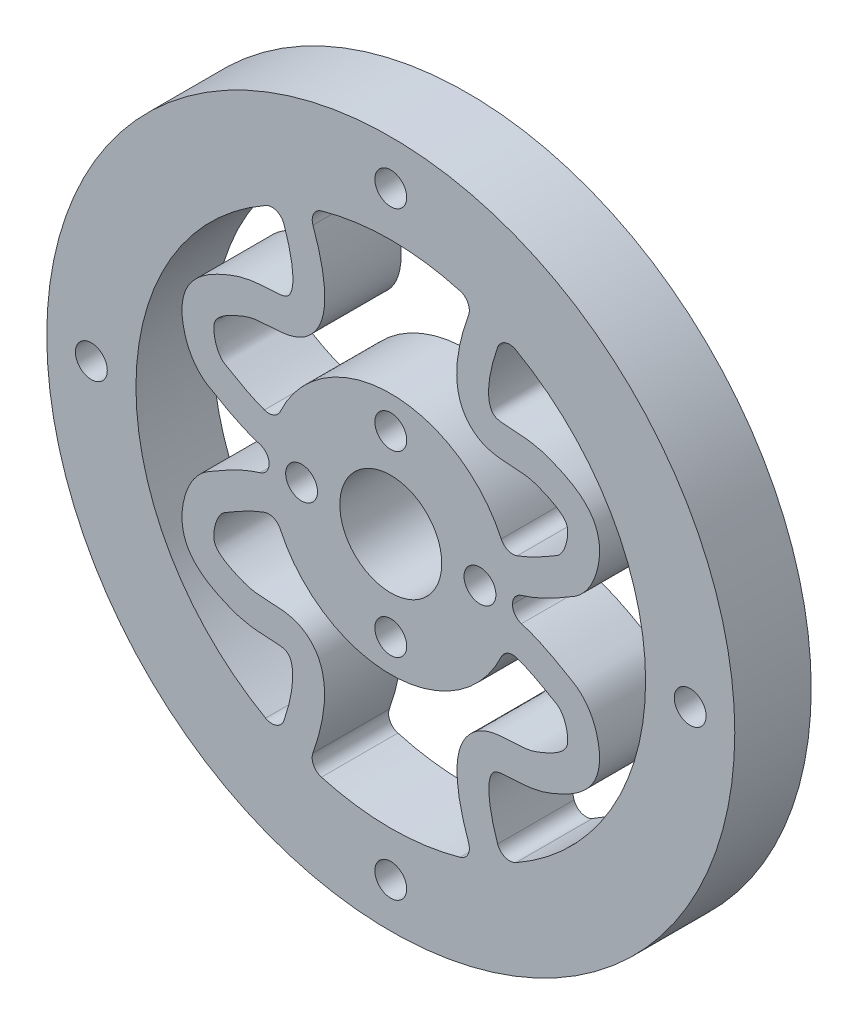
from build123d import *

# Parameters (mm, degrees)
BOSS_EXTRUDE1_OUTLINE_R   = 27
BOSS_EXTRUDE1_OUTLINE_R_2 = 1.25
BOSS_EXTRUDE1_OUTLINE_R_3 = 4
BOSS_EXTRUDE1_DEPTH       = 6
FILLET1_R                 = 1


# Read off the part's stored shape, not the designer's step: Boss-Extrude1
with BuildPart() as part:
    # Boss-Extrude1 outline → Boss-Extrude1 (new body)
    with BuildSketch(Plane.XY):
        Circle(BOSS_EXTRUDE1_OUTLINE_R)
        with Locations((0, -23.5)):
            Circle(BOSS_EXTRUDE1_OUTLINE_R_2, mode=Mode.SUBTRACT)
        with BuildLine():
            add(Edge.make_bspline(
                [(6.483801843, -18.919839155), (6.480612205, -18.912032776), (6.441503957, -18.816167051), (6.347612357, -18.58122213), (6.119029267, -17.980388927), (5.789810817, -17.013794353), (5.429669957, -15.668496809), (5.191806498, -14.230135337), (5.175407974, -12.761834066), (5.524401823, -11.283291588), (6.409718684, -10.166991751), (7.454125678, -9.625091073), (8.350033292, -9.42542645), (9.170309196, -9.376479516), (9.947678619, -9.350570154), (10.675240534, -9.288463207), (11.237211138, -9.169079776), (11.932036453, -8.89638821), (12.637697815, -8.576891164), (13.211834821, -8.233451201), (13.613150576, -7.882315625), (13.813065964, -7.569945647), (13.896838471, -7.281813359), (13.879539964, -6.641593544), (13.73039878, -6.059941379), (13.55175681, -5.653270156), (13.396702845, -5.396835282), (13.265283039, -5.238744867), (13.160626685, -5.14359219), (13.101918554, -5.098485448), (12.979648753, -5.022079201), (12.577995362, -4.7934595), (11.724742054, -4.291783433), (10.601060528, -3.730602471), (9.652508015, -3.377233049), (9.21951845, -3.260097231), (8.993066806, -3.214723866)],
                knots=[0.007762367, 0.007762367, 0.007762367, 0.007762367, 0.009702959, 0.03125, 0.0625, 0.125, 0.1875, 0.25, 0.3125, 0.375, 0.4375, 0.46875, 0.5, 0.53125, 0.5625, 0.59375, 0.625, 0.65625, 0.6875, 0.71875, 0.75, 0.78125, 0.8125, 0.84375, 0.875, 0.890625, 0.90625, 0.921875, 0.9296875, 0.9375, 0.9453125, 0.953125, 0.96875, 0.984375, 0.9921875, 1, 1, 1, 1], degree=3))
            ThreePointArc((6.483801843, -18.919839155), (0, -20), (-6.483801843, -18.919839155))
            add(Edge.make_bspline(
                [(-6.483801843, -18.919839155), (-6.480612205, -18.912032776), (-6.441503957, -18.816167051), (-6.347612357, -18.58122213), (-6.119029267, -17.980388927), (-5.789810817, -17.013794353), (-5.429669957, -15.668496809), (-5.191806498, -14.230135337), (-5.175407974, -12.761834066), (-5.524401823, -11.283291588), (-6.409718684, -10.166991751), (-7.454125678, -9.625091073), (-8.350033292, -9.42542645), (-9.170309196, -9.376479516), (-9.947678619, -9.350570154), (-10.675240534, -9.288463207), (-11.237211138, -9.169079776), (-11.932036453, -8.89638821), (-12.637697815, -8.576891164), (-13.211834821, -8.233451201), (-13.613150576, -7.882315625), (-13.813065964, -7.569945647), (-13.896838471, -7.281813359), (-13.879539964, -6.641593544), (-13.73039878, -6.059941379), (-13.55175681, -5.653270156), (-13.396702845, -5.396835282), (-13.265283039, -5.238744867), (-13.160626685, -5.14359219), (-13.101918554, -5.098485448), (-12.979648753, -5.022079201), (-12.577995362, -4.7934595), (-11.724742054, -4.291783433), (-10.601060528, -3.730602471), (-9.652508015, -3.377233049), (-9.21951845, -3.260097231), (-8.993066806, -3.214723866)],
                knots=[0.007762367, 0.007762367, 0.007762367, 0.007762367, 0.009702959, 0.03125, 0.0625, 0.125, 0.1875, 0.25, 0.3125, 0.375, 0.4375, 0.46875, 0.5, 0.53125, 0.5625, 0.59375, 0.625, 0.65625, 0.6875, 0.71875, 0.75, 0.78125, 0.8125, 0.84375, 0.875, 0.890625, 0.90625, 0.921875, 0.9296875, 0.9375, 0.9453125, 0.953125, 0.96875, 0.984375, 0.9921875, 1, 1, 1, 1], degree=3))
            ThreePointArc((-8.993066806, -3.214723866), (0, -9.550376962), (8.993066806, -3.214723866))
        make_face(mode=Mode.SUBTRACT)
        with Locations((0, -7)):
            Circle(BOSS_EXTRUDE1_OUTLINE_R_2, mode=Mode.SUBTRACT)
        with Locations((-23.5, 0)):
            Circle(BOSS_EXTRUDE1_OUTLINE_R_2, mode=Mode.SUBTRACT)
        with BuildLine():
            add(Edge.make_bspline(
                [(-8.793765965, -17.963008661), (-8.790561612, -17.955152681), (-8.757299555, -17.873459033), (-8.675456351, -17.668379774), (-8.473919568, -17.138762569), (-8.182262794, -16.281745106), (-7.874017475, -15.126473634), (-7.688580164, -13.981174059), (-7.68708969, -12.988779781), (-7.882450811, -12.340385911), (-8.105574911, -12.101711107), (-8.427286637, -11.936185887), (-9.255887466, -11.873584818), (-10.061993387, -11.846676872), (-10.980530297, -11.780784628), (-12.037855007, -11.548544014), (-12.901369588, -11.200056501), (-14.054290483, -10.681134366), (-15.231238441, -9.924658048), (-16.128927134, -8.661627788), (-16.433708137, -7.419671476), (-16.361750971, -6.266622794), (-16.068776901, -5.081044273), (-15.596575411, -4.134652828), (-15.106286502, -3.535992931), (-14.774613082, -3.227707308), (-14.488277389, -3.0127142), (-14.214236794, -2.847608081), (-13.840221024, -2.635292087), (-12.932474986, -2.101308455), (-11.383068607, -1.322241381), (-10.154677906, -0.901179774), (-9.522201544, -0.770857912), (-9.519265086, -0.770254719)],
                knots=[0.008782184, 0.008782184, 0.008782184, 0.008782184, 0.01097773, 0.03125, 0.0625, 0.125, 0.1875, 0.25, 0.3125, 0.375, 0.4375, 0.5, 0.53125, 0.5625, 0.59375, 0.625, 0.65625, 0.6875, 0.75, 0.78125, 0.8125, 0.84375, 0.875, 0.90625, 0.921875, 0.9296875, 0.9375, 0.9453125, 0.953125, 0.96875, 0.984375, 0.999644738, 0.99971579, 0.99971579, 0.99971579, 0.99971579], degree=3))
            ThreePointArc((-8.793765965, -17.963008661), (-20, 0), (-8.793765965, 17.963008661))
            add(Edge.make_bspline(
                [(-8.793765965, 17.963008661), (-8.792390185, 17.959667216), (-8.751090896, 17.859289875), (-8.659149113, 17.630898508), (-8.442492857, 17.062585707), (-8.150200233, 16.204626452), (-7.847022713, 15.063271185), (-7.669490667, 13.941546746), (-7.675936835, 12.977642097), (-7.87172167, 12.356105989), (-8.096556435, 12.116445797), (-8.437268015, 11.945555936), (-9.265970028, 11.877370514), (-10.069148732, 11.843745886), (-10.982990761, 11.771223658), (-12.032129114, 11.536768835), (-12.892956915, 11.190784402), (-14.04568893, 10.675396667), (-15.225024196, 9.924481098), (-16.127345354, 8.662487813), (-16.433024316, 7.418347937), (-16.360717665, 6.265882856), (-16.068019021, 5.080296428), (-15.595762735, 4.133827462), (-15.105222866, 3.535092161), (-14.773373049, 3.226801646), (-14.486865721, 3.011813821), (-14.212855625, 2.846812002), (-13.839019105, 2.634637657), (-12.931736587, 2.100862468), (-11.383019871, 1.3220545), (-10.15471139, 0.901122285), (-9.522198334, 0.770856958), (-9.519265086, 0.770254719)],
                knots=[0.003708072, 0.003708072, 0.003708072, 0.003708072, 0.00463509, 0.03125, 0.0625, 0.125, 0.1875, 0.25, 0.3125, 0.375, 0.4375, 0.5, 0.53125, 0.5625, 0.59375, 0.625, 0.65625, 0.6875, 0.75, 0.78125, 0.8125, 0.84375, 0.875, 0.90625, 0.921875, 0.9296875, 0.9375, 0.9453125, 0.953125, 0.96875, 0.984375, 0.999645143, 0.999716115, 0.999716115, 0.999716115, 0.999716115], degree=3))
            ThreePointArc((-9.519265086, 0.770254719), (-9.550376962, 0), (-9.519265086, -0.770254719))
        make_face(mode=Mode.SUBTRACT)
        with Locations((-7, 0)):
            Circle(BOSS_EXTRUDE1_OUTLINE_R_2, mode=Mode.SUBTRACT)
        Circle(BOSS_EXTRUDE1_OUTLINE_R_3, mode=Mode.SUBTRACT)
        with Locations((7, 0)):
            Circle(BOSS_EXTRUDE1_OUTLINE_R_2, mode=Mode.SUBTRACT)
        with Locations((0, 7)):
            Circle(BOSS_EXTRUDE1_OUTLINE_R_2, mode=Mode.SUBTRACT)
        with BuildLine():
            add(Edge.make_bspline(
                [(-6.483801843, 18.919839155), (-6.482428599, 18.916506133), (-6.435464145, 18.802446138), (-6.331751534, 18.544967686), (-6.088032516, 17.905633276), (-5.757506339, 16.936431605), (-5.401217095, 15.600475059), (-5.170938786, 14.177815551), (-5.164642087, 12.726303988), (-5.529593155, 11.262265681), (-6.422218406, 10.16816807), (-7.45697845, 9.636564412), (-8.34365536, 9.435395123), (-9.159513397, 9.380214885), (-9.934554469, 9.347855416), (-10.662113343, 9.280670847), (-11.229957293, 9.157678589), (-11.928251207, 8.884298538), (-12.636049231, 8.566038906), (-13.211909719, 8.224307826), (-13.613520282, 7.875254277), (-13.812127691, 7.566169682), (-13.895424665, 7.281234026), (-13.878139336, 6.639916023), (-13.729050873, 6.058586057), (-13.550532405, 5.652168502), (-13.395576418, 5.39596311), (-13.264221021, 5.238013923), (-13.159545079, 5.142897705), (-13.100787625, 5.097777089), (-12.978253874, 5.021254727), (-12.576385364, 4.792575773), (-11.723550617, 4.29110232), (-10.60055857, 3.730267544), (-9.65244952, 3.377137573), (-9.219480083, 3.260062194), (-8.993066806, 3.214723866)],
                knots=[0.003301299, 0.003301299, 0.003301299, 0.003301299, 0.004126624, 0.03125, 0.0625, 0.125, 0.1875, 0.25, 0.3125, 0.375, 0.4375, 0.46875, 0.5, 0.53125, 0.5625, 0.59375, 0.625, 0.65625, 0.6875, 0.71875, 0.75, 0.78125, 0.8125, 0.84375, 0.875, 0.890625, 0.90625, 0.921875, 0.9296875, 0.9375, 0.9453125, 0.953125, 0.96875, 0.984375, 0.9921875, 1, 1, 1, 1], degree=3))
            ThreePointArc((-6.483801843, 18.919839155), (0, 20), (6.483801843, 18.919839155))
            add(Edge.make_bspline(
                [(6.483801843, 18.919839155), (6.427558814, 18.784051049), (6.324537132, 18.529168098), (6.073882061, 17.871349196), (5.745428657, 16.907087807), (5.392085426, 15.577928796), (5.165001465, 14.161924058), (5.162032487, 12.716063833), (5.531376946, 11.256563451), (6.425565101, 10.168329975), (7.457974124, 9.63919877), (8.342543019, 9.437703347), (9.157376636, 9.381112059), (9.931882007, 9.347282574), (10.659445482, 9.278940922), (11.228646085, 9.155126895), (11.927746574, 8.881616393), (12.636043239, 8.56367028), (13.212306684, 8.222358626), (13.613990776, 7.873804728), (13.812299546, 7.565496628), (13.895496378, 7.281312129), (13.878231204, 6.639848031), (13.729136155, 6.05855138), (13.550624612, 5.652134143), (13.39567622, 5.395932335), (13.264328523, 5.237983984), (13.159663821, 5.142870471), (13.10090948, 5.097749149), (12.978423161, 5.021248624), (12.576606002, 4.792594285), (11.723719853, 4.29112662), (10.600636073, 3.730284389), (9.652465038, 3.377144046), (9.219486979, 3.260065429), (8.993066806, 3.214723866)],
                knots=[2.7542e-05, 2.7542e-05, 2.7542e-05, 2.7542e-05, 0.03125, 0.0625, 0.125, 0.1875, 0.25, 0.3125, 0.375, 0.4375, 0.46875, 0.5, 0.53125, 0.5625, 0.59375, 0.625, 0.65625, 0.6875, 0.71875, 0.75, 0.78125, 0.8125, 0.84375, 0.875, 0.890625, 0.90625, 0.921875, 0.9296875, 0.9375, 0.9453125, 0.953125, 0.96875, 0.984375, 0.9921875, 1, 1, 1, 1], degree=3))
            ThreePointArc((8.993066806, 3.214723866), (0, 9.550376962), (-8.993066806, 3.214723866))
        make_face(mode=Mode.SUBTRACT)
        with BuildLine():
            add(Edge.make_bspline(
                [(8.793765964, 17.963008661), (8.743696315, 17.842124252), (8.652024593, 17.615315229), (8.428556729, 17.028880945), (8.138535996, 16.176583266), (7.838516203, 15.04335892), (7.664046059, 13.930304494), (7.672917525, 12.974810129), (7.868875384, 12.359933936), (8.09461171, 12.119578752), (8.439880369, 11.947457623), (9.268619588, 11.87798157), (10.071117318, 11.842821716), (10.983851503, 11.768791985), (12.03106163, 11.533866993), (12.89126609, 11.188486281), (14.043949333, 10.673948938), (15.223811446, 9.924371515), (16.12718592, 8.662713201), (16.433111818, 7.418171723), (16.360730957, 6.265768417), (16.068051422, 5.080203116), (15.595819703, 4.133782126), (15.105329849, 3.535077718), (14.773513769, 3.226799381), (14.487046012, 3.011821514), (14.213025533, 2.846799467), (13.839137176, 2.634594588), (12.931786752, 2.100819871), (11.38089886, 1.320987455), (10.135468469, 0.896850952), (9.519264913, 0.770256852)],
                knots=[3.1817e-05, 3.1817e-05, 3.1817e-05, 3.1817e-05, 0.03125, 0.0625, 0.125, 0.1875, 0.25, 0.3125, 0.375, 0.4375, 0.5, 0.53125, 0.5625, 0.59375, 0.625, 0.65625, 0.6875, 0.75, 0.78125, 0.8125, 0.84375, 0.875, 0.90625, 0.921875, 0.9296875, 0.9375, 0.9453125, 0.953125, 0.96875, 0.984375, 0.99970761, 0.99970761, 0.99970761, 0.99970761], degree=3))
            ThreePointArc((8.793765964, 17.963008661), (20, 0), (8.793765965, -17.963008661))
            add(Edge.make_bspline(
                [(8.793765965, -17.963008661), (8.790561612, -17.955152681), (8.757299555, -17.873459033), (8.675456351, -17.668379774), (8.473919568, -17.138762569), (8.182262794, -16.281745106), (7.874017475, -15.126473634), (7.688580163, -13.981174059), (7.68708969, -12.988779781), (7.882450811, -12.340385911), (8.105574911, -12.101711107), (8.427286637, -11.936185887), (9.255887466, -11.873584818), (10.061993387, -11.846676872), (10.980530297, -11.780784628), (12.037855007, -11.548544014), (12.901369588, -11.200056501), (14.054290483, -10.681134366), (15.231238441, -9.924658048), (16.128927134, -8.661627788), (16.433708137, -7.419671476), (16.361750971, -6.266622794), (16.068776901, -5.081044273), (15.596575411, -4.134652828), (15.106286502, -3.535992931), (14.774613082, -3.227707308), (14.488277389, -3.0127142), (14.214236794, -2.847608081), (13.840221024, -2.635292087), (12.932474986, -2.101308455), (11.383068607, -1.322241381), (10.154677906, -0.901179774), (9.522201544, -0.770857912), (9.519265086, -0.770254719)],
                knots=[0.008782184, 0.008782184, 0.008782184, 0.008782184, 0.01097773, 0.03125, 0.0625, 0.125, 0.1875, 0.25, 0.3125, 0.375, 0.4375, 0.5, 0.53125, 0.5625, 0.59375, 0.625, 0.65625, 0.6875, 0.75, 0.78125, 0.8125, 0.84375, 0.875, 0.90625, 0.921875, 0.9296875, 0.9375, 0.9453125, 0.953125, 0.96875, 0.984375, 0.999644738, 0.99971579, 0.99971579, 0.99971579, 0.99971579], degree=3))
            ThreePointArc((9.519265086, -0.770254719), (9.550376962, 1.07e-06), (9.519264913, 0.770256852))
        make_face(mode=Mode.SUBTRACT)
        with Locations((23.5, 0)):
            Circle(BOSS_EXTRUDE1_OUTLINE_R_2, mode=Mode.SUBTRACT)
        with Locations((0, 23.5)):
            Circle(BOSS_EXTRUDE1_OUTLINE_R_2, mode=Mode.SUBTRACT)
    extrude(amount=BOSS_EXTRUDE1_DEPTH)

    # Fillet1
    fillet1_edges = [part.edges().sort_by_distance(p)[0] for p in [
        (8.993066806, 3.214723866, 3),
        (-8.993066806, 3.214723866, 3),
        (9.519264913, 0.770256852, 3),
        (9.519265086, -0.770254719, 3),
        (8.993066806, -3.214723866, 3),
        (-8.993066806, -3.214723866, 3),
        (-9.519265086, 0.770254719, 3),
        (-9.519265086, -0.770254719, 3),
        (6.483801843, -18.919839155, 3),
        (-8.793765965, -17.963008661, 3),
        (8.793765965, -17.963008661, 3),
        (6.483801843, 18.919839155, 3),
        (8.793765964, 17.963008661, 3),
        (-6.483801843, -18.919839155, 3),
        (-6.483801843, 18.919839155, 3),
        (-8.793765965, 17.963008661, 3),
    ]]
    fillet(fillet1_edges, radius=FILLET1_R)


solid = part.part
